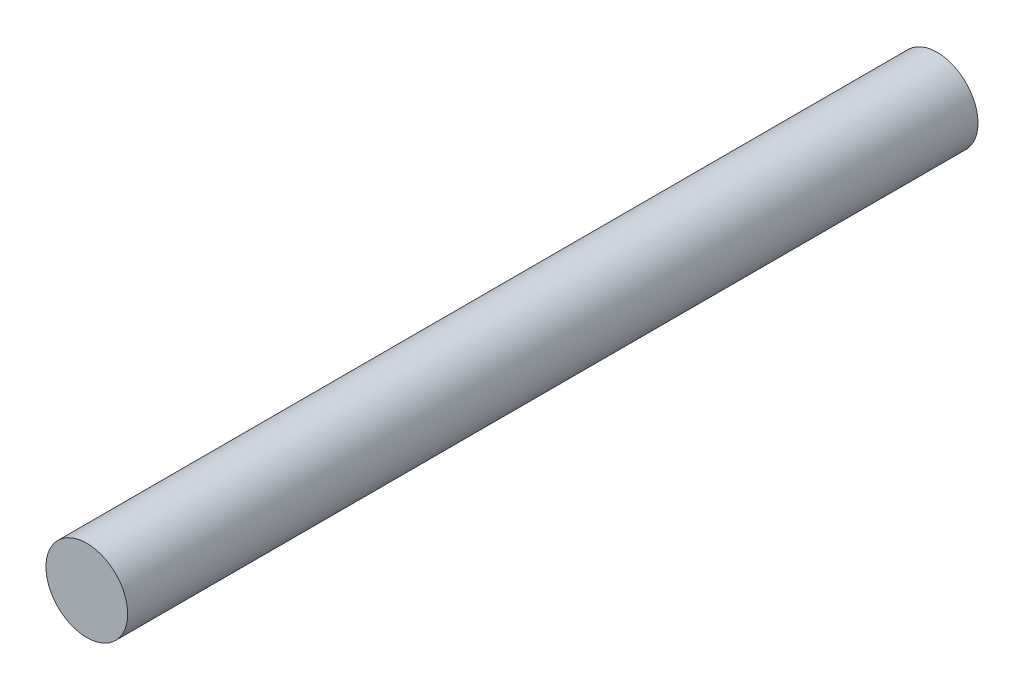
from build123d import *

# Parameters (mm, degrees)
BOSS_EXTRUDE1_OUTLINE_R = 6.35
BOSS_EXTRUDE1_DEPTH     = 132.09778


# Read off the part's stored shape, not the designer's step: Boss-Extrude1
with BuildPart() as part:
    # Boss-Extrude1 outline → Boss-Extrude1 (new body)
    with BuildSketch(Plane.XY.offset(-22.86)):
        Circle(BOSS_EXTRUDE1_OUTLINE_R)
    extrude(amount=BOSS_EXTRUDE1_DEPTH)


solid = part.part
